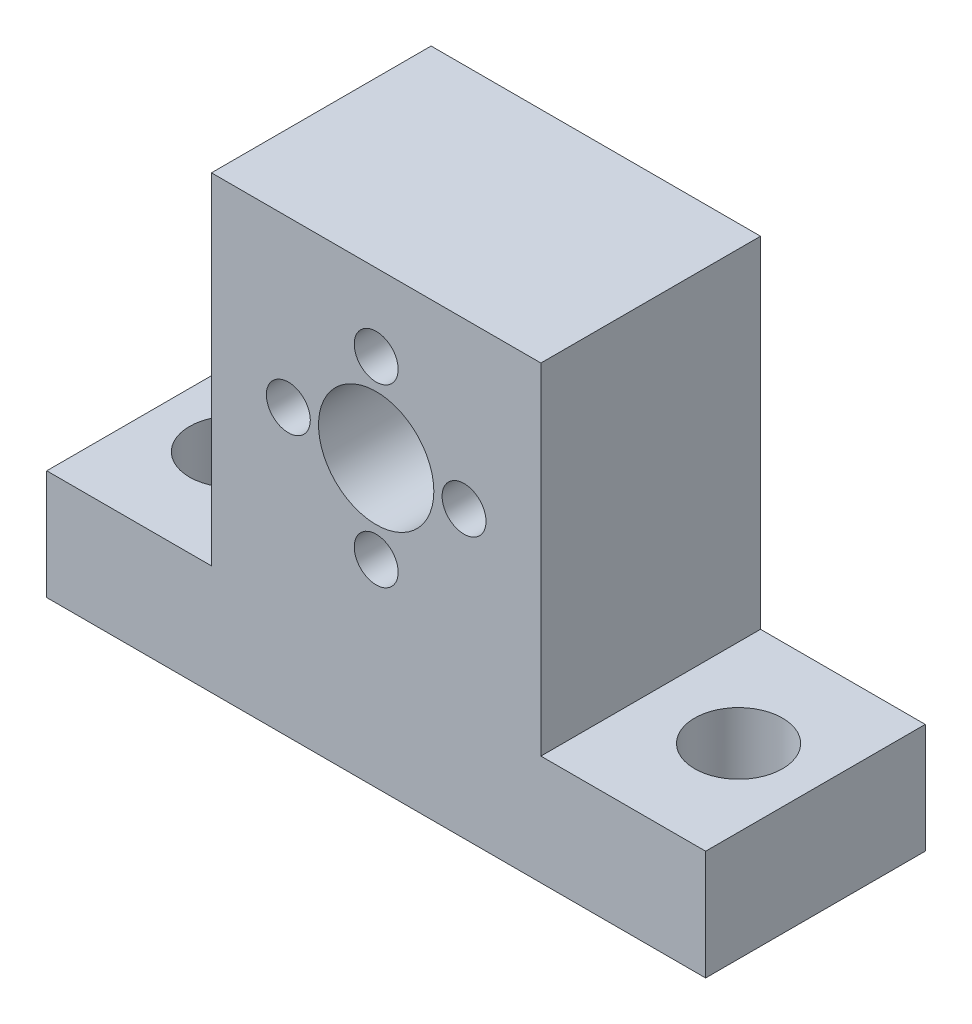
from build123d import *

# Parameters (mm, degrees)
SKETCH1_W           = 60
SKETCH1_H           = 41
SKETCH1_R           = 5.25
SKETCH1_R_2         = 2
BOSS_EXTRUDE1_DEPTH = 20
SKETCH2_R           = 4
CUT_EXTRUDE1_DEPTH  = 55.598534779
SKETCH3_W           = 15
SKETCH3_H           = 31
CUT_EXTRUDE2_DEPTH  = 45.452221542


with BuildPart() as part:
    # Sketch1 → Boss-Extrude1 (new body)
    with BuildSketch(Plane.XY):
        with Locations((0, -5.5)):
            Rectangle(SKETCH1_W, SKETCH1_H)
        Circle(SKETCH1_R, mode=Mode.SUBTRACT)
        with Locations((0, 8)):
            Circle(SKETCH1_R_2, mode=Mode.SUBTRACT)
        with Locations((8, 0)):
            Circle(SKETCH1_R_2, mode=Mode.SUBTRACT)
        with Locations((0, -8)):
            Circle(SKETCH1_R_2, mode=Mode.SUBTRACT)
        with Locations((-8, 0)):
            Circle(SKETCH1_R_2, mode=Mode.SUBTRACT)
    extrude(amount=BOSS_EXTRUDE1_DEPTH)

    # Sketch2 → Cut-Extrude1 (cut, through all)
    with BuildSketch(Plane(origin=(0, 15, 0), x_dir=(1, 0, 0), z_dir=(0, 1, 0))):
        with Locations((-23, -10)):
            Circle(SKETCH2_R)
        with Locations((23, -10)):
            Circle(SKETCH2_R)
    extrude(amount=-CUT_EXTRUDE1_DEPTH, mode=Mode.SUBTRACT)

    # Sketch3 → Cut-Extrude2 (cut, through all)
    with BuildSketch(Plane(origin=(0, 0, 0), x_dir=(-1, 0, 0), z_dir=(0, 0, -1))):
        with Locations((-22.5, -0.5)):
            Rectangle(SKETCH3_W, SKETCH3_H)
        with Locations((22.5, -0.5)):
            Rectangle(SKETCH3_W, SKETCH3_H)
    extrude(amount=-CUT_EXTRUDE2_DEPTH, mode=Mode.SUBTRACT)


solid = part.part
